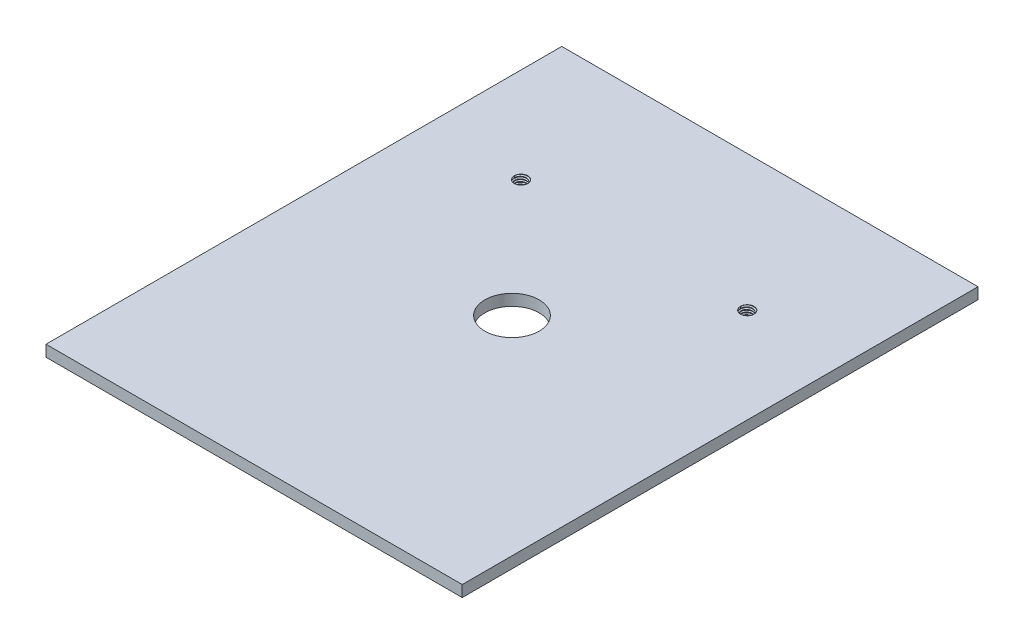
from build123d import *
from build123d.topology import SkipClean

# Parameters (mm, degrees)
BOSS_EXTRUDE1_DEPTH     = 5
SKETCH2_R               = 3.0000000000000018
SKETCH2_R_2             = 12
CUT_EXTRUDE1_DEPTH      = 147.57762448614048
THREAD2_PITCH           = 1
THREAD3_PITCH           = 1
CUT_EXTRUDE2_DEPTH      = 147.61008731505666
CUT_EXTRUDE2_DEPTH_BACK = 147.61008731505666
SKETCH3_W               = 6.854101492961995
SKETCH3_H               = 6


with BuildPart() as part:
    # Sketch1 → Boss-Extrude1 (new body)
    with BuildSketch(Plane(origin=(0, 0, 0), x_dir=(1, 0, 0), z_dir=(0, 1, 0))):
        Polygon((-92, 113.99999999999999), (92, 113.99999999999999), (92.00000000000003, -114.00000000000001), (-91.99999999999997, -114.00000000000001), align=None)
    extrude(amount=BOSS_EXTRUDE1_DEPTH)

    # Sketch2 → Cut-Extrude1 (cut, through all)
    with BuildSketch(Plane(origin=(0, 5, 0), x_dir=(1, 0, 0), z_dir=(0, 1, 0))):
        with Locations(Location((-50, 53.99999999999999, 0), (0, 0, 270))):
            Circle(SKETCH2_R)
        with Locations(Location((50, 53.99999999999999, 0), (0, 0, 270))):
            Circle(SKETCH2_R)
        with Locations(Location((0, 0, 0), (0, 0, 270))):
            Circle(SKETCH2_R_2)
    extrude(amount=-CUT_EXTRUDE1_DEPTH, mode=Mode.SUBTRACT)

    # Thread2: the profile of Thread Profile3 profile screwed along a right-hand helix of 10 turns, 8 arcs to a turn; built about Z, then put on its axis
    thread2_z = Axis((0, 0, 0), (0, 0, 1))
    thread2_corners = [(3.0003, 0, -0.000173205), (3.0003, 0, 0.875173202), (2.458734125, 0, 0.562499999), (2.458734125, 0, 0.312499999)]
    with BuildLine(mode=Mode.PRIVATE) as thread2_profile:
        Line(thread2_corners[0], thread2_corners[1])
        Line(thread2_corners[1], thread2_corners[2])
        Line(thread2_corners[2], thread2_corners[3])
        Line(thread2_corners[3], thread2_corners[0])
    thread2_cap = Face(thread2_profile.wire())
    thread2_turn_angles = [0, 22.5, 45, 67.5, 90, 112.5, 135, 157.5, 180, 202.5, 225, 247.5, 270, 292.5, 315, 337.5, 360]
    thread2_turn_weights = [1, 0.9238795325112867, 1, 0.9238795325112867, 1, 0.9238795325112867, 1, 0.9238795325112867, 1, 0.9238795325112867, 1, 0.9238795325112867, 1, 0.9238795325112867, 1, 0.9238795325112867, 1]
    thread2_turn_rails = [Edge.make_bspline([Vector(p[0], p[1], 0).rotate(thread2_z, thread2_turn_angles[k]) / thread2_turn_weights[k] + Vector(0, 0, p[2] + THREAD2_PITCH * thread2_turn_angles[k] / 360) for k in range(17)], [0, 0, 0, 1, 1, 2, 2, 3, 3, 4, 4, 5, 5, 6, 6, 7, 7, 8, 8, 8], 2, thread2_turn_weights) for p in thread2_corners]
    thread2_turn_sides = [Face.make_surface_from_curves(thread2_turn_rails[p[0]], thread2_turn_rails[p[1]]) for p in [(0, 1), (1, 2), (2, 3), (3, 0)]]
    thread2 = Plane(origin=(-50, 5, -54), x_dir=(-1, 0, 0), z_dir=(0, -1, 0)) * Solid(Shell([*[p.moved(Location((0, 0, THREAD2_PITCH * i))) for i in range(10) for p in thread2_turn_sides], thread2_cap, thread2_cap.rotate(thread2_z, 3600).moved(Location((0, 0, THREAD2_PITCH * 3600 / 360)))]))
    add(thread2)

    # Thread3: the profile of Thread Profile4 profile screwed along a right-hand helix of 10 turns, 8 arcs to a turn; built about Z, then put on its axis
    with SkipClean():  # the faces are left unmerged after this step: merging them gives an invalid solid
        thread3_z = Axis((0, 0, 0), (0, 0, 1))
        thread3_corners = [(3.0003, 0, -0.000173205), (3.0003, 0, 0.875173202), (2.458734125, 0, 0.562499999), (2.458734125, 0, 0.312499999)]
        with BuildLine(mode=Mode.PRIVATE) as thread3_profile:
            Line(thread3_corners[0], thread3_corners[1])
            Line(thread3_corners[1], thread3_corners[2])
            Line(thread3_corners[2], thread3_corners[3])
            Line(thread3_corners[3], thread3_corners[0])
        thread3_cap = Face(thread3_profile.wire())
        thread3_turn_angles = [0, 22.5, 45, 67.5, 90, 112.5, 135, 157.5, 180, 202.5, 225, 247.5, 270, 292.5, 315, 337.5, 360]
        thread3_turn_weights = [1, 0.9238795325112867, 1, 0.9238795325112867, 1, 0.9238795325112867, 1, 0.9238795325112867, 1, 0.9238795325112867, 1, 0.9238795325112867, 1, 0.9238795325112867, 1, 0.9238795325112867, 1]
        thread3_turn_rails = [Edge.make_bspline([Vector(p[0], p[1], 0).rotate(thread3_z, thread3_turn_angles[k]) / thread3_turn_weights[k] + Vector(0, 0, p[2] + THREAD3_PITCH * thread3_turn_angles[k] / 360) for k in range(17)], [0, 0, 0, 1, 1, 2, 2, 3, 3, 4, 4, 5, 5, 6, 6, 7, 7, 8, 8, 8], 2, thread3_turn_weights) for p in thread3_corners]
        thread3_turn_sides = [Face.make_surface_from_curves(thread3_turn_rails[p[0]], thread3_turn_rails[p[1]]) for p in [(0, 1), (1, 2), (2, 3), (3, 0)]]
        thread3 = Plane(origin=(50, 5, -54), x_dir=(-1, 0, 0), z_dir=(0, -1, 0)) * Solid(Shell([*[p.moved(Location((0, 0, THREAD3_PITCH * i))) for i in range(10) for p in thread3_turn_sides], thread3_cap, thread3_cap.rotate(thread3_z, 3600).moved(Location((0, 0, THREAD3_PITCH * 3600 / 360)))]))
        add(thread3)

    # Sketch3 → Cut-Extrude2 (cut, two sides: drawn at the far end of the back side and taken through both)
    with SkipClean():  # the faces are left unmerged after this step: merging them gives an invalid solid
        with BuildSketch(Plane(origin=(0, 0, 0), x_dir=(0, 0, -1), z_dir=(1, 0, 0)).offset(-CUT_EXTRUDE2_DEPTH_BACK)):
            with Locations((53.97609519971547, -3)):
                Rectangle(SKETCH3_W, SKETCH3_H)
        extrude(amount=CUT_EXTRUDE2_DEPTH + CUT_EXTRUDE2_DEPTH_BACK, mode=Mode.SUBTRACT)


solid = part.part
